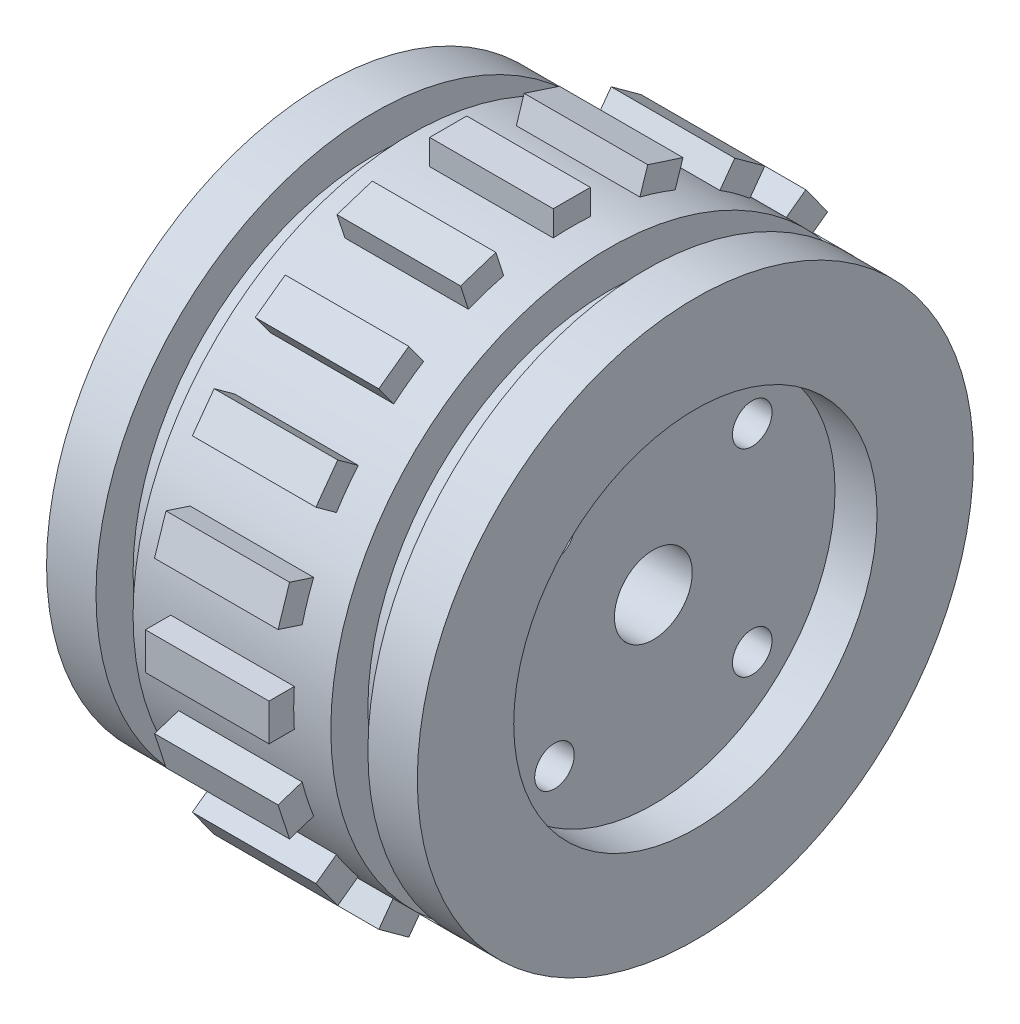
from build123d import *

# Parameters (mm, degrees)
SKETCH_5_R               = 1.6
CUT_EXTRUDE_1_DEPTH      = 42.473606065
SKETCH_6_R               = 2.85
CUT_EXTRUDE_2_DEPTH      = 3
CHAMFER_1_SIZE           = 5
CHAMFER_1_SIZE_2         = 6.164015259
CHAMFER_2_SIZE           = 2
CHAMFER_2_SIZE2          = 2.465606104
SKETCH_8_W               = 3
SKETCH_8_H               = 4
SKETCH_56_W              = 10
SKETCH_56_H              = 3.522984106
EXTRUDE_2_DEPTH          = 1.5
PATTERN_CIRCULAR_2_COUNT = 20


with BuildPart() as part:
    # Эскиз4 → Повернуть1 (revolve)
    with BuildSketch(Plane.XY, mode=Mode.PRIVATE) as revolve_1_sk:
        Polygon((-30, 22.5), (-30, 18.491274218), (-10.2, 15), (-10.2, 3.15), (-3.4, 3.15), (-3.4, 14.7), (0, 14.7), (0, 22.5), align=None)
    revolve(revolve_1_sk.sketch.rotate(Axis((-30, 0, 0), (1, 0, 0)), 90), axis=Axis((-30, 0, 0), (1, 0, 0)))

    # Эскиз5 → Вырез-Вытянуть1 (cut, through all)
    with BuildSketch(Plane(origin=(-3.4, 0, 0), x_dir=(0, 0, -1), z_dir=(1, 0, 0))):
        with Locations((8.000913229, 8.000913229)):
            Circle(SKETCH_5_R)
        with Locations((-8.000913229, 8.000913229)):
            Circle(SKETCH_5_R)
        with Locations((-8.000913229, -8.000913229)):
            Circle(SKETCH_5_R)
        with Locations((8.000913229, -8.000913229)):
            Circle(SKETCH_5_R)
    extrude(amount=-CUT_EXTRUDE_1_DEPTH, mode=Mode.SUBTRACT)

    # Эскиз6 → Вырез-Вытянуть2 (cut)
    with BuildSketch(Plane.ZY.offset(10.2)):
        with Locations((-8.000913229, 8.000913229)):
            Circle(SKETCH_6_R)
        with Locations((8.000913229, 8.000913229)):
            Circle(SKETCH_6_R)
        with Locations((8.000913229, -8.000913229)):
            Circle(SKETCH_6_R)
        with Locations((-8.000913229, -8.000913229)):
            Circle(SKETCH_6_R)
    extrude(amount=-CUT_EXTRUDE_2_DEPTH, mode=Mode.SUBTRACT)

    # Фаска1
    # the kernel refuses this chamfer: 6.164015259, 5 mm, written as the material it adds along each edge
    with BuildSketch(Plane(origin=(-10.2, 0, 0), x_dir=(0, 0, 1), z_dir=(0, 1, 0))) as chamfer_1_piece_1_section:
        Polygon((15 + CHAMFER_1_SIZE * 0.173648177667, -CHAMFER_1_SIZE * 0.984807753012), (15 - CHAMFER_1_SIZE_2, 0), (15, 0), align=None)
    chamfer_1_piece_1 = revolve(axis=Axis((-10.2, 0, 0), (1, 0, 0)), mode=Mode.PRIVATE)
    chamfer_1_piece_1 = chamfer_1_piece_1 - Plane(origin=(-12.574838132, 8.000913229, -8.000913229), x_dir=(0, 0, 1), z_dir=(-1, 0, 0)) * Cylinder(2.85, 64, mode=Mode.PRIVATE)
    chamfer_1_piece_1 = chamfer_1_piece_1 - Plane(origin=(-12.574838132, 8.000913229, 8.000913229), x_dir=(0, 0, 1), z_dir=(-1, 0, 0)) * Cylinder(2.85, 64, mode=Mode.PRIVATE)
    chamfer_1_piece_1 = chamfer_1_piece_1 - Plane(origin=(-12.574838132, -8.000913229, -8.000913229), x_dir=(0, 0, 1), z_dir=(-1, 0, 0)) * Cylinder(2.85, 64, mode=Mode.PRIVATE)
    chamfer_1_piece_1 = chamfer_1_piece_1 - Plane(origin=(-12.574838132, -8.000913229, 8.000913229), x_dir=(0, 0, 1), z_dir=(-1, 0, 0)) * Cylinder(2.85, 64, mode=Mode.PRIVATE)
    add(chamfer_1_piece_1)

    # Фаска2
    chamfer_2_edges = [part.edges().sort_by_distance(p)[0] for p in [
        (-30, 0, -18.491274218),
    ]]
    chamfer_2_side = [part.faces().sort_by_distance(p)[0] for p in [
        (-30, 0, -21.863603897),
    ]]
    chamfer(chamfer_2_edges, length=CHAMFER_2_SIZE, length2=CHAMFER_2_SIZE2, reference=chamfer_2_side[0])

    # Эскиз8 → Вырез-Повернуть1 (revolve, cut)
    with BuildSketch(Plane.XY, mode=Mode.PRIVATE) as cut_revolve_1_sk:
        with Locations((-24.5, 21.5)):
            Rectangle(SKETCH_8_W, SKETCH_8_H)
        with Locations((-5.5, 21.5)):
            Rectangle(SKETCH_8_W, SKETCH_8_H)
    revolve(cut_revolve_1_sk.sketch.rotate(Axis((-30, 0, 0), (1, 0, 0)), 90), axis=Axis((-30, 0, 0), (1, 0, 0)), mode=Mode.SUBTRACT)

    # Эскиз56 → Бобышка-Вытянуть2 (add, symmetric)
    with BuildSketch(Plane.XY):
        with Locations((-15, 22.738507947)):
            Rectangle(SKETCH_56_W, SKETCH_56_H)
    extrude_2 = extrude(amount=EXTRUDE_2_DEPTH, both=True)

    # Круговой массив2: Бобышка-Вытянуть2 ×20 about axis
    pattern_circular_2_axis = Axis((0, 0, 0), (1, 0, 0))
    for i in range(1, PATTERN_CIRCULAR_2_COUNT):
        add(extrude_2.rotate(pattern_circular_2_axis, i * 360 / PATTERN_CIRCULAR_2_COUNT))


solid = part.part
